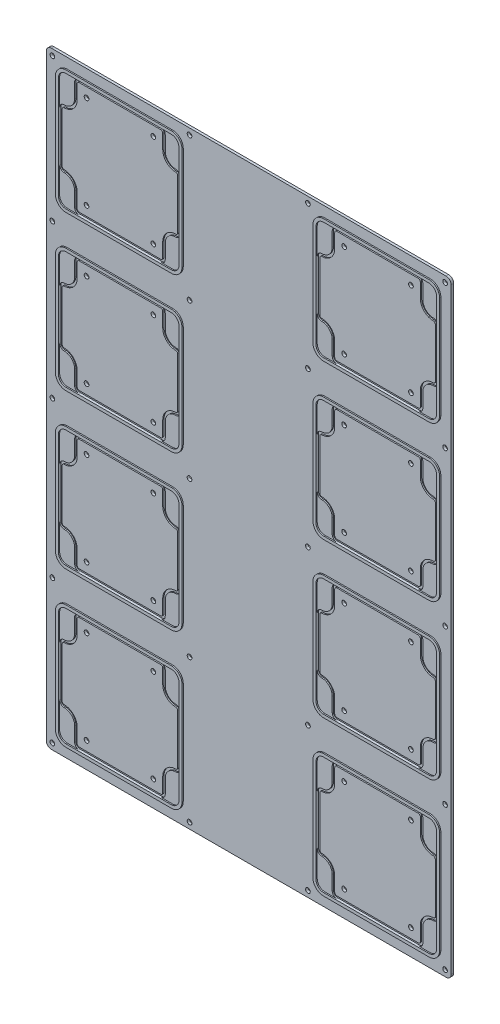
from build123d import *

# Parameters (mm, degrees)
SKETCH1_W            = 254
SKETCH1_H            = 381
BOSS_EXTRUDE1_DEPTH  = 1.5875
SKETCH2_R            = 1.4732
CUT_EXTRUDE1_DEPTH   = 458.907763809
FILLET1_R            = 3.175
CUT_EXTRUDE2_DEPTH   = 0.79375
BOSS_EXTRUDE2_DEPTH  = 0.79375
SKETCH5_R            = 1.4732
CUT_EXTRUDE3_DEPTH   = 458.907763809
LPATTERN1_COUNT      = 4
LPATTERN1_PITCH      = 96.8756
LPATTERN1_COUNT_DIR2 = 2
LPATTERN1_PITCH_DIR2 = 161.5948


with BuildPart() as part:
    # Sketch1 → Boss-Extrude1 (new body)
    with BuildSketch(Plane.XY):
        with Locations((127, 190.5)):
            Rectangle(SKETCH1_W, SKETCH1_H)
    extrude(amount=BOSS_EXTRUDE1_DEPTH)

    # Sketch2 → Cut-Extrude1 (cut, through all)
    with BuildSketch(Plane.XY.offset(1.5875)):
        with Locations((3.81, 377.19)):
            Circle(SKETCH2_R)
        with Locations((89.8652, 377.19)):
            Circle(SKETCH2_R)
        with Locations((164.1348, 377.19)):
            Circle(SKETCH2_R)
        with Locations((250.19, 377.19)):
            Circle(SKETCH2_R)
        with Locations((164.1348, 287.375451288)):
            Circle(SKETCH2_R)
        with Locations((3.81, 287.3756)):
            Circle(SKETCH2_R)
        with Locations((250.19, 287.3756)):
            Circle(SKETCH2_R)
        with Locations((89.8652, 287.3756)):
            Circle(SKETCH2_R)
        with Locations((164.1348, 190.499990436)):
            Circle(SKETCH2_R)
        with Locations((3.81, 191.135)):
            Circle(SKETCH2_R)
        with Locations((250.19, 190.5)):
            Circle(SKETCH2_R)
        with Locations((89.8652, 190.5)):
            Circle(SKETCH2_R)
        with Locations((164.1348, 93.6244)):
            Circle(SKETCH2_R)
        with Locations((3.81, 93.6244)):
            Circle(SKETCH2_R)
        with Locations((250.19, 93.6244)):
            Circle(SKETCH2_R)
        with Locations((89.8652, 93.6244)):
            Circle(SKETCH2_R)
        with Locations((164.1348, 3.81)):
            Circle(SKETCH2_R)
        with Locations((3.81, 3.81)):
            Circle(SKETCH2_R)
        with Locations((250.19, 3.81)):
            Circle(SKETCH2_R)
        with Locations((89.8652, 3.81)):
            Circle(SKETCH2_R)
    extrude(amount=-CUT_EXTRUDE1_DEPTH, mode=Mode.SUBTRACT)

    # Fillet1
    fillet1_edges = [part.edges().sort_by_distance(p)[0] for p in [
        (254, 0, 0.79375),
        (0, 0, 0.79375),
        (254, 381, 0.79375),
        (0, 381, 0.79375),
    ]]
    fillet(fillet1_edges, radius=FILLET1_R)

    # Sketch3 → Cut-Extrude2 (cut)
    with BuildSketch(Plane.XY.offset(1.5875)):
        with BuildLine():
            Line((17.78, 79.1718), (17.78, 70.1802))
            ThreePointArc((17.78, 70.1802), (15.853172671, 65.528427329), (11.2014, 63.6016))
            ThreePointArc((11.2014, 63.6016), (9.207783141, 62.775816859), (8.382, 60.7822))
            Line((8.382, 60.7822), (8.382, 29.591))
            ThreePointArc((8.382, 29.591), (9.207783141, 27.597383141), (11.2014, 26.7716))
            ThreePointArc((11.2014, 26.7716), (15.853172671, 24.844772671), (17.78, 20.193))
            Line((17.78, 20.193), (17.78, 11.2014))
            ThreePointArc((17.78, 11.2014), (18.605783141, 9.207783141), (20.5994, 8.382))
            Line((20.5994, 8.382), (71.8058, 8.382))
            ThreePointArc((71.8058, 8.382), (73.799416859, 9.207783141), (74.6252, 11.2014))
            Line((74.6252, 11.2014), (74.6252, 20.193))
            ThreePointArc((74.6252, 20.193), (76.552027329, 24.844772671), (81.2038, 26.7716))
            ThreePointArc((81.2038, 26.7716), (83.197416859, 27.597383141), (84.0232, 29.591))
            Line((84.0232, 29.591), (84.0232, 60.7822))
            ThreePointArc((84.0232, 60.7822), (83.197416859, 62.775816859), (81.2038, 63.6016))
            ThreePointArc((81.2038, 63.6016), (76.552027329, 65.528427329), (74.6252, 70.1802))
            Line((74.6252, 70.1802), (74.6252, 79.1718))
            ThreePointArc((74.6252, 79.1718), (73.799416859, 81.165416859), (71.8058, 81.9912))
            Line((71.8058, 81.9912), (20.5994, 81.9912))
            ThreePointArc((20.5994, 81.9912), (18.605783141, 81.165416859), (17.78, 79.1718))
        make_face()
        with BuildLine():
            Line((82.4357, 29.591), (82.4357, 60.7822))
            ThreePointArc((82.4357, 60.7822), (82.074884844, 61.653284844), (81.2038, 62.0141))
            ThreePointArc((81.2038, 62.0141), (75.429495314, 64.405895314), (73.0377, 70.1802))
            Line((73.0377, 70.1802), (73.0377, 79.1718))
            ThreePointArc((73.0377, 79.1718), (72.676884844, 80.042884844), (71.8058, 80.4037))
            Line((71.8058, 80.4037), (20.5994, 80.4037))
            ThreePointArc((20.5994, 80.4037), (19.728315156, 80.042884844), (19.3675, 79.1718))
            Line((19.3675, 79.1718), (19.3675, 70.1802))
            ThreePointArc((19.3675, 70.1802), (16.975704686, 64.405895314), (11.2014, 62.0141))
            ThreePointArc((11.2014, 62.0141), (10.330315156, 61.653284844), (9.9695, 60.7822))
            Line((9.9695, 60.7822), (9.9695, 29.591))
            ThreePointArc((9.9695, 29.591), (10.330315156, 28.719915156), (11.2014, 28.3591))
            ThreePointArc((11.2014, 28.3591), (16.975704686, 25.967304686), (19.3675, 20.193))
            Line((19.3675, 20.193), (19.3675, 11.2014))
            ThreePointArc((19.3675, 11.2014), (19.728315156, 10.330315156), (20.5994, 9.9695))
            Line((20.5994, 9.9695), (71.8058, 9.9695))
            ThreePointArc((71.8058, 9.9695), (72.676884844, 10.330315156), (73.0377, 11.2014))
            Line((73.0377, 11.2014), (73.0377, 20.193))
            ThreePointArc((73.0377, 20.193), (75.429495314, 25.967304686), (81.2038, 28.3591))
            ThreePointArc((81.2038, 28.3591), (82.074884844, 28.719915156), (82.4357, 29.591))
        make_face(mode=Mode.SUBTRACT)
    cut_extrude2 = extrude(amount=-CUT_EXTRUDE2_DEPTH, mode=Mode.SUBTRACT)

    # Sketch4 → Boss-Extrude2 (add)
    with BuildSketch(Plane.XY.offset(1.5875)):
        with BuildLine():
            Line((6.477, 60.7822), (6.477, 77.2287))
            ThreePointArc((6.477, 77.2287), (8.429865536, 81.943334464), (13.1445, 83.8962))
            Line((13.1445, 83.8962), (20.5994, 83.8962))
            Line((20.5994, 83.8962), (79.2607, 83.8962))
            ThreePointArc((79.2607, 83.8962), (83.975334464, 81.943334464), (85.9282, 77.2287))
            Line((85.9282, 77.2287), (85.9282, 13.1445))
            ThreePointArc((85.9282, 13.1445), (83.975334464, 8.429865536), (79.2607, 6.477))
            Line((79.2607, 6.477), (13.1445, 6.477))
            ThreePointArc((13.1445, 6.477), (8.429865536, 8.429865536), (6.477, 13.1445))
            Line((6.477, 13.1445), (6.477, 60.7822))
        make_face()
        with BuildLine():
            Line((8.382, 60.7822), (8.382, 77.2287))
            ThreePointArc((8.382, 77.2287), (9.776903955, 80.596296045), (13.1445, 81.9912))
            Line((13.1445, 81.9912), (20.5994, 81.9912))
            Line((20.5994, 81.9912), (79.2607, 81.9912))
            ThreePointArc((79.2607, 81.9912), (82.628296045, 80.596296045), (84.0232, 77.2287))
            Line((84.0232, 77.2287), (84.0232, 13.1445))
            ThreePointArc((84.0232, 13.1445), (82.628296045, 9.776903955), (79.2607, 8.382))
            Line((79.2607, 8.382), (13.1445, 8.382))
            ThreePointArc((13.1445, 8.382), (9.776903955, 9.776903955), (8.382, 13.1445))
            Line((8.382, 13.1445), (8.382, 60.7822))
        make_face(mode=Mode.SUBTRACT)
    boss_extrude2 = extrude(amount=BOSS_EXTRUDE2_DEPTH)

    # Sketch5 → Cut-Extrude3 (cut, through all)
    with BuildSketch(Plane.XY.offset(1.5875)):
        with Locations((25.2476, 74.3966)):
            Circle(SKETCH5_R)
        with Locations((67.1576, 74.3966)):
            Circle(SKETCH5_R)
        with Locations((67.1576, 15.9766)):
            Circle(SKETCH5_R)
        with Locations((25.2476, 15.9766)):
            Circle(SKETCH5_R)
    cut_extrude3 = extrude(amount=-CUT_EXTRUDE3_DEPTH, mode=Mode.SUBTRACT)

    # LPattern1: Cut-Extrude2, Boss-Extrude2, Cut-Extrude3 4 × 2
    with Locations(*[(j * LPATTERN1_PITCH_DIR2, i * LPATTERN1_PITCH, 0) for i in range(LPATTERN1_COUNT) for j in range(LPATTERN1_COUNT_DIR2) if (i, j) != (0, 0)]):
        add(cut_extrude2, mode=Mode.SUBTRACT)
        add(boss_extrude2)
        add(cut_extrude3, mode=Mode.SUBTRACT)


solid = part.part
